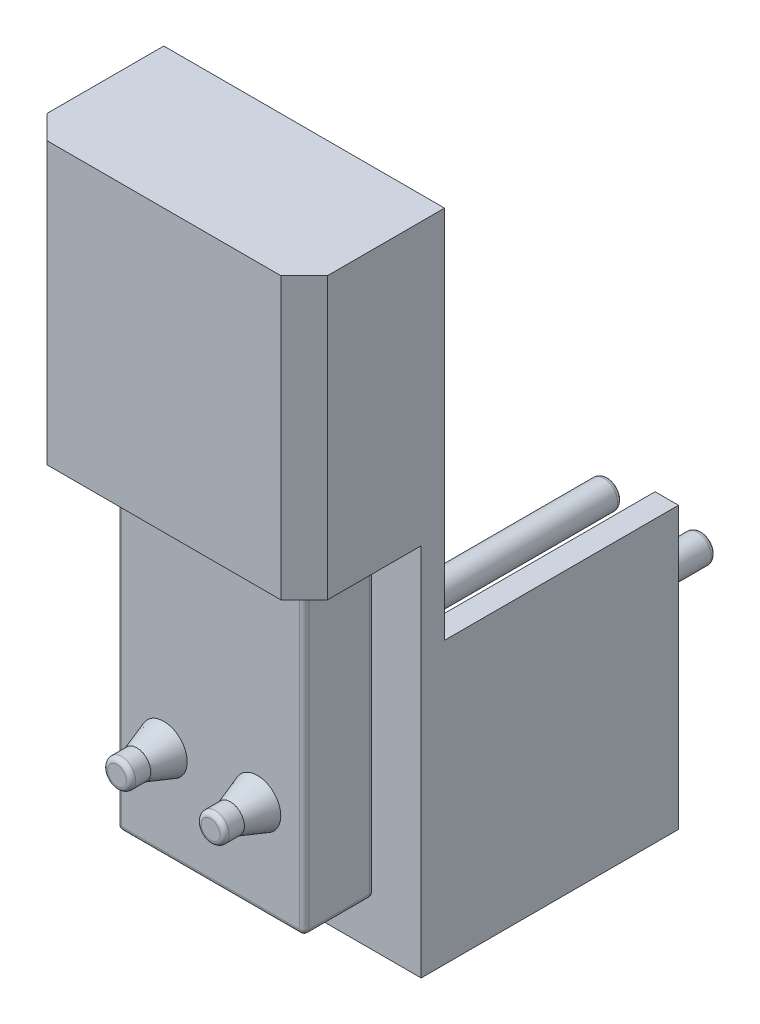
from build123d import *

# Parameters (mm, degrees)
BOSS_EXTRUDE1_DEPTH           = 5
BOSS_EXTRUDE2_DEPTH           = 0.5
BOSS_EXTRUDE3_DEPTH           = 2
BOSS_EXTRUDE4_REACH           = 14.5
BOSS_EXTRUDE5_DEPTH           = 6
SKETCH10_W                    = 4
SKETCH10_H                    = 11.5
BOSS_EXTRUDE6_DEPTH           = 1.5
FILLET1_R                     = 0.1
CHAMFER1_SIZE                 = 0.5
SKETCH11_R                    = 1.5
BOSS_EXTRUDE7_DEPTH           = 0.1
FILLET2_R                     = 0.1
BOSS_EXTRUDE8_DEPTH           = 1
BOSS_EXTRUDE8_DEPTH_BACK      = 9.5
SKETCH12_R                    = 0.3
BOSS_EXTRUDE8_2_DEPTH         = 1
BOSS_EXTRUDE8_2_DEPTH_BACK    = 9.5
FILLET4_R                     = 0.1
FILLET5_R                     = 0.1
SKETCH13_R                    = 0.5
BOSS_EXTRUDE9_DEPTH           = 0.9
BOSS_EXTRUDE9_DRAFT           = 19
BOSS_EXTRUDE9_PROFILE_2_DEPTH = 0.9
BOSS_EXTRUDE9_PROFILE_2_DRAFT = 19


# Read off the part's stored shape, not the designer's step: Dome1
with BuildPart() as part:
    # Sketch1 → Boss-Extrude1 (new body)
    with BuildSketch(Plane.XY):
        Polygon((0.5, 0.5), (0.5, 4), (0, 4), (0, 0), (6, 0), (6, 6), (5.5, 6), (5.5, 0.5), align=None)
    extrude(amount=BOSS_EXTRUDE1_DEPTH)

    # Sketch2 → Boss-Extrude2 (add)
    with BuildSketch(Plane.XY.offset(5)):
        Polygon((6, 6), (6, 14), (0, 14), (0, 4), (0, 0), (6, 0), align=None)
    extrude(amount=BOSS_EXTRUDE2_DEPTH)

    # Sketch3 → Boss-Extrude3 (add)
    with BuildSketch(Plane.XY.offset(5.5)):
        Polygon((0, 14), (6, 14), (6, 8), (5.5, 8), (5.5, 13.5), (0.5, 13.5), (0.5, 8), (0, 8), align=None)
    extrude(amount=BOSS_EXTRUDE3_DEPTH)

    # Boss-Extrude4: up to this face of the body (flat: up to its plane)
    boss_extrude4_end = Plane(part.part.faces().sort_by_distance((3, 14, 6.25))[0])
    # Sketch8 → Boss-Extrude4 (add, up to the picked face)
    with BuildSketch(Plane(origin=(0, 8, 0), x_dir=(-1, 0, 0), z_dir=(0, -1, 0)), mode=Mode.PRIVATE) as boss_extrude4_sk1:
        Polygon((-0.5, -7.5), (-1, -8), (-0.5, -8), (0, -7.5), align=None)
    boss_extrude4_tool1 = split(extrude(boss_extrude4_sk1.sketch, amount=-BOSS_EXTRUDE4_REACH, mode=Mode.PRIVATE), bisect_by=boss_extrude4_end, keep=Keep.BOTH, mode=Mode.PRIVATE)
    # Sketch8 → Boss-Extrude4 (add, up to the picked face)
    with BuildSketch(Plane(origin=(0, 8, 0), x_dir=(-1, 0, 0), z_dir=(0, -1, 0)), mode=Mode.PRIVATE) as boss_extrude4_sk2:
        Polygon((-6, -7.5), (-5.5, -7.5), (-5, -8), (-5.5, -8), align=None)
    boss_extrude4_tool2 = split(extrude(boss_extrude4_sk2.sketch, amount=-BOSS_EXTRUDE4_REACH, mode=Mode.PRIVATE), bisect_by=boss_extrude4_end, keep=Keep.BOTH, mode=Mode.PRIVATE)
    add(boss_extrude4_tool1.solids().sort_by(Axis((0.5, 8, 7.75), (0, 1, 0)))[0])
    add(boss_extrude4_tool2.solids().sort_by(Axis((5.5, 8, 7.75), (0, 1, 0)))[0])

    # Sketch9 → Boss-Extrude5 (add)
    with BuildSketch(Plane(origin=(0, 14, 0), x_dir=(1, 0, 0), z_dir=(0, 1, 0))):
        Polygon((0.5, -7.5), (5.5, -7.5), (5, -8), (1, -8), align=None)
    extrude(amount=-BOSS_EXTRUDE5_DEPTH)

    # Chamfer1
    chamfer1_edges = [part.edges().sort_by_distance(p)[0] for p in [
        (0.5, 10.75, 7.5),
        (5.5, 10.75, 7.5),
    ]]
    chamfer(chamfer1_edges, length=CHAMFER1_SIZE)


with BuildPart() as body_2:
    # Sketch10 → Boss-Extrude6 (new body)
    with BuildSketch(Plane.XY.offset(5.5)):
        with Locations((3, 6.75)):
            Rectangle(SKETCH10_W, SKETCH10_H)
    extrude(amount=BOSS_EXTRUDE6_DEPTH)

    # Fillet1
    fillet1_edges = [body_2.edges().sort_by_distance(p)[0] for p in [
        (5, 6.75, 7),
        (3, 12.5, 7),
        (1, 6.75, 7),
        (5, 6.75, 5.5),
        (3, 1, 5.5),
        (1, 6.75, 5.5),
        (3, 1, 7),
    ]]
    fillet(fillet1_edges, radius=FILLET1_R)

    # Fillet2
    # the kernel refuses this fillet: 0.1 mm, written as the material it takes off along each edge
    with BuildSketch(Plane(origin=(4.9, 1.1, 6.9), x_dir=(1, 0, 0), z_dir=(0, -1, 0))) as fillet2_piece_1_section:
        Polygon((0, 0), (FILLET2_R, 0), (FILLET2_R, FILLET2_R), (0, FILLET2_R), align=None)
    fillet2_piece_1 = extrude(amount=FILLET2_R, mode=Mode.PRIVATE)
    fillet2_piece_1 = fillet2_piece_1 - Plane(origin=(4.9, 1.1, 6.9), x_dir=(-0.7071067811865475, 0, -0.7071067811865475), z_dir=(0, -1, 0)) * Sphere(FILLET2_R, mode=Mode.PRIVATE)
    add(fillet2_piece_1, mode=Mode.SUBTRACT)
    with BuildSketch(Plane(origin=(1.1, 1.1, 6.9), x_dir=(-1, 0, 0), z_dir=(0, -1, 0))) as fillet2_piece_2_section:
        Polygon((0, 0), (FILLET2_R, 0), (FILLET2_R, -FILLET2_R), (0, -FILLET2_R), align=None)
    fillet2_piece_2 = extrude(amount=FILLET2_R, mode=Mode.PRIVATE)
    fillet2_piece_2 = fillet2_piece_2 - Plane(origin=(1.1, 1.1, 6.9), x_dir=(0.7071067811865475, 0, -0.7071067811865475), z_dir=(0, -1, 0)) * Sphere(FILLET2_R, mode=Mode.PRIVATE)
    add(fillet2_piece_2, mode=Mode.SUBTRACT)
    with BuildSketch(Plane(origin=(1.1, 1.1, 5.6), x_dir=(-1, 0, 0), z_dir=(0, -1, 0))) as fillet2_piece_3_section:
        Polygon((0, 0), (FILLET2_R, 0), (FILLET2_R, FILLET2_R), (0, FILLET2_R), align=None)
    fillet2_piece_3 = extrude(amount=FILLET2_R, mode=Mode.PRIVATE)
    fillet2_piece_3 = fillet2_piece_3 - Plane(origin=(1.1, 1.1, 5.6), x_dir=(0.7071067811865475, 0, 0.7071067811865475), z_dir=(0, -1, 0)) * Sphere(FILLET2_R, mode=Mode.PRIVATE)
    add(fillet2_piece_3, mode=Mode.SUBTRACT)
    with BuildSketch(Plane(origin=(4.9, 1.1, 5.6), x_dir=(1, 0, 0), z_dir=(0, -1, 0))) as fillet2_piece_4_section:
        Polygon((0, 0), (FILLET2_R, 0), (FILLET2_R, -FILLET2_R), (0, -FILLET2_R), align=None)
    fillet2_piece_4 = extrude(amount=FILLET2_R, mode=Mode.PRIVATE)
    fillet2_piece_4 = fillet2_piece_4 - Plane(origin=(4.9, 1.1, 5.6), x_dir=(-0.7071067811865475, 0, 0.7071067811865475), z_dir=(0, -1, 0)) * Sphere(FILLET2_R, mode=Mode.PRIVATE)
    add(fillet2_piece_4, mode=Mode.SUBTRACT)
    with BuildSketch(Plane(origin=(5, 1, 5.6), x_dir=(-1, 0, 0), z_dir=(0, 0, 1))) as fillet2_piece_5:
        with BuildLine():
            CenterArc((FILLET2_R, -FILLET2_R), FILLET2_R, 90, 90)
            Line((0, -FILLET2_R), (0, 0))
            Line((0, 0), (FILLET2_R, 0))
        make_face()
    extrude(amount=1.3, mode=Mode.SUBTRACT)
    with BuildSketch(Plane(origin=(1, 1, 5.6), x_dir=(1, 0, 0), z_dir=(0, 0, 1))) as fillet2_piece_6:
        with BuildLine():
            CenterArc((FILLET2_R, FILLET2_R), FILLET2_R, 180, 90)
            Line((0, FILLET2_R), (0, 0))
            Line((0, 0), (FILLET2_R, 0))
        make_face()
    extrude(amount=1.3, mode=Mode.SUBTRACT)


with BuildPart() as body_3:
    # Sketch11 → Boss-Extrude7 (new body)
    with BuildSketch(Plane(origin=(0, 0, 5), x_dir=(-1, 0, 0), z_dir=(0, 0, -1))):
        with Locations((-3, 11)):
            Circle(SKETCH11_R)
    extrude(amount=BOSS_EXTRUDE7_DEPTH)

    # Dome1 outline → Dome1 (revolve)
    with BuildSketch(Plane(origin=(3, 11, 0), x_dir=(1, 0, 0), z_dir=(0, -1, 0))):
        with BuildLine():
            Line((0, 4.900000002), (0, 4.4))
            ThreePointArc((0, 4.4), (0.790569416, 4.528291755), (1.500000002, 4.900000002))
            Line((1.500000002, 4.900000002), (0, 4.900000002))
        make_face()
    revolve(axis=Axis((3, 11, 0), (0, 0, 1)))


with BuildPart() as body_4:
    # Sketch12 → Boss-Extrude8 (new, two sides: drawn at the far end of the back side and taken through both)
    with BuildSketch(Plane.XY.offset(7).offset(-BOSS_EXTRUDE8_DEPTH_BACK)):
        with Locations((2, 3)):
            Circle(SKETCH12_R)
    extrude(amount=BOSS_EXTRUDE8_DEPTH + BOSS_EXTRUDE8_DEPTH_BACK)

    # Fillet5
    fillet5_edges = [body_4.edges().sort_by_distance(p)[0] for p in [
        (1.7, 3, -2.5),
        (1.7, 3, 8),
    ]]
    fillet(fillet5_edges, radius=FILLET5_R)


with BuildPart() as body_5:
    # Sketch12 → Boss-Extrude8 2 (new, two sides: drawn at the far end of the back side and taken through both)
    with BuildSketch(Plane.XY.offset(7).offset(-BOSS_EXTRUDE8_2_DEPTH_BACK)):
        with Locations((4, 3)):
            Circle(SKETCH12_R)
    extrude(amount=BOSS_EXTRUDE8_2_DEPTH + BOSS_EXTRUDE8_2_DEPTH_BACK)

    # Fillet4
    fillet4_edges = [body_5.edges().sort_by_distance(p)[0] for p in [
        (3.7, 3, -2.5),
        (3.7, 3, 8),
    ]]
    fillet(fillet4_edges, radius=FILLET4_R)


with BuildPart() as body_6:
    # Sketch13 → Boss-Extrude9 (with draft: the straight prism first)
    with BuildSketch(Plane.XY.offset(7)):
        with Locations((2, 3)):
            Circle(SKETCH13_R)
    extrude(amount=BOSS_EXTRUDE9_DEPTH)
    # Boss-Extrude9: the draft: its side faces are tilted about the plane it starts from
    boss_extrude9_sides = [body_6.faces().sort_by_distance(p)[0] for p in [
        (1.5, 3, 7.45),
    ]]
    draft(boss_extrude9_sides, Plane.XY.offset(7), BOSS_EXTRUDE9_DRAFT)


with BuildPart() as body_7:
    # Sketch13 → Boss-Extrude9 profile 2 (with draft: the straight prism first)
    with BuildSketch(Plane.XY.offset(7)):
        with Locations((4, 3)):
            Circle(SKETCH13_R)
    extrude(amount=BOSS_EXTRUDE9_PROFILE_2_DEPTH)
    # Boss-Extrude9 profile 2: the draft: its side faces are tilted about the plane it starts from
    boss_extrude9_profile_2_sides = [body_7.faces().sort_by_distance(p)[0] for p in [
        (3.5, 3, 7.45),
    ]]
    draft(boss_extrude9_profile_2_sides, Plane.XY.offset(7), BOSS_EXTRUDE9_PROFILE_2_DRAFT)


solid = Compound([part.part, body_2.part, body_3.part, body_4.part, body_5.part, body_6.part, body_7.part])
